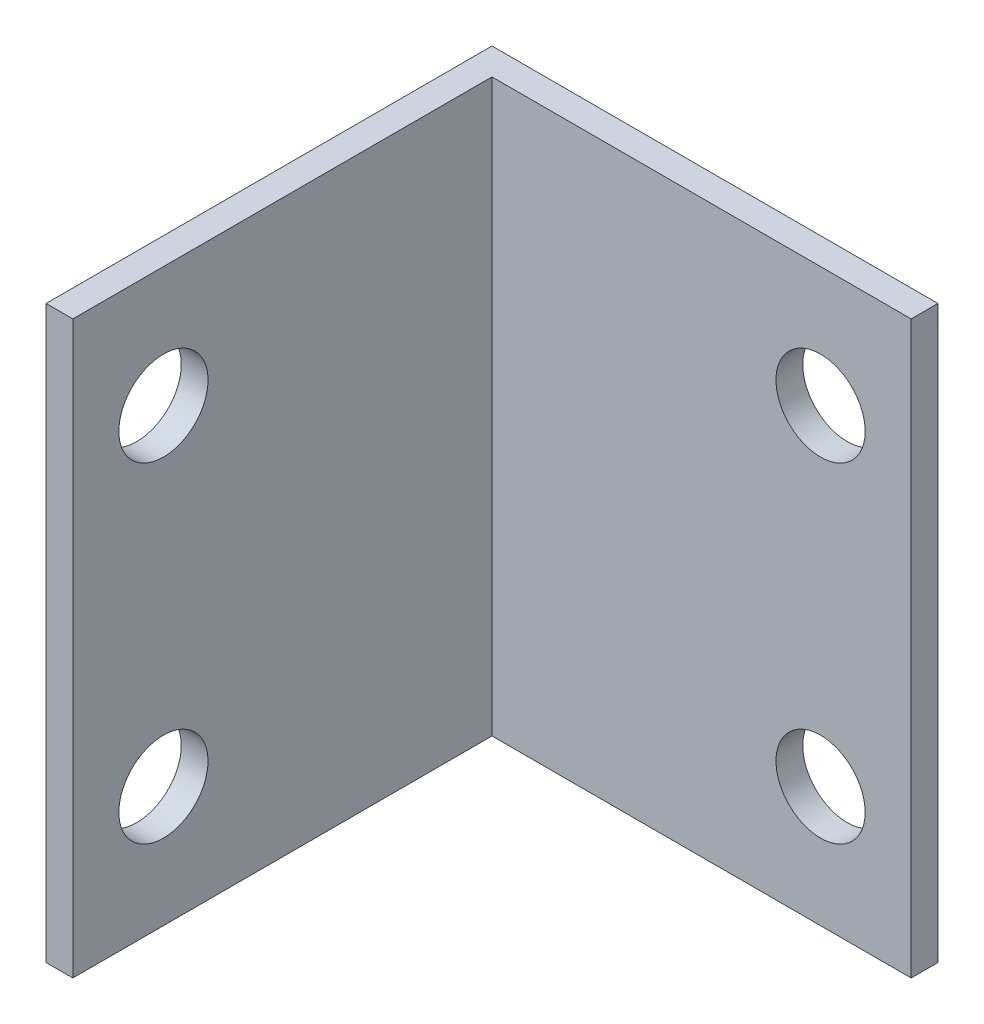
from build123d import *

# Parameters (mm, degrees)
SKETCH1_W           = 25
SKETCH1_H           = 32
SKETCH1_R           = 2.5
BOSS_EXTRUDE1_DEPTH = 1.5
SKETCH2_W           = 25
SKETCH2_H           = 32
SKETCH2_R           = 2.5
BOSS_EXTRUDE2_DEPTH = 1.5


with BuildPart() as part:
    # Sketch1 → Boss-Extrude1 (new body)
    with BuildSketch(Plane.XY):
        Rectangle(SKETCH1_W, SKETCH1_H)
        with Locations((7.42, -9.25)):
            Circle(SKETCH1_R, mode=Mode.SUBTRACT)
        with Locations((7.42, 9.25)):
            Circle(SKETCH1_R, mode=Mode.SUBTRACT)
    extrude(amount=BOSS_EXTRUDE1_DEPTH)

    # Sketch2 → Boss-Extrude2 (add)
    with BuildSketch(Plane.ZY.offset(12.5)):
        with Locations((12.5, 0)):
            Rectangle(SKETCH2_W, SKETCH2_H)
        with Locations((19.92, -9.25)):
            Circle(SKETCH2_R, mode=Mode.SUBTRACT)
        with Locations((19.92, 9.25)):
            Circle(SKETCH2_R, mode=Mode.SUBTRACT)
    extrude(amount=-BOSS_EXTRUDE2_DEPTH)


solid = part.part
